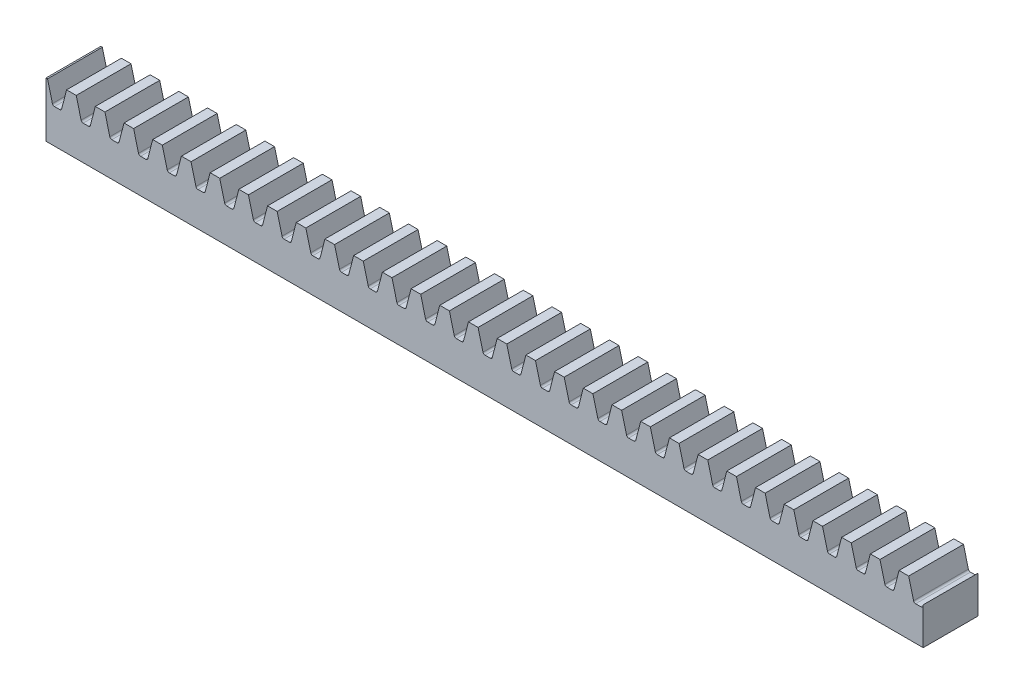
from build123d import *

# Parameters (mm, degrees)
SKETCH1_W           = 304.8
SKETCH1_H           = 6.35
BOSS_EXTRUDE1_DEPTH = 3.175
CUT_EXTRUDE1_DEPTH  = 6.35
FILLET3_R           = 0.244816447
LPATTERN4_START     = -3.175
LPATTERN4_DEPTH     = 6.35
SKETCH3_W           = 203.2
SKETCH3_H           = 22.446230099
CUT_EXTRUDE2_DEPTH  = 153.565274965


with BuildPart() as part:
    # Sketch1 → Boss-Extrude1 (new, symmetric)
    with BuildSketch(Plane.XY):
        Rectangle(SKETCH1_W, SKETCH1_H)
    extrude(amount=BOSS_EXTRUDE1_DEPTH, both=True)

    # Sketch2 → Cut-Extrude1 (cut)
    with BuildSketch(Plane.XY.offset(3.175)):
        Polygon((-151.84248861, 3.175), (-151.227202895, 0.795866667), (-150.247937105, 0.795866667), (-149.63265139, 3.175), align=None)
    extrude(amount=-CUT_EXTRUDE1_DEPTH, mode=Mode.SUBTRACT)

    # Fillet3
    fillet3_edges = [part.edges().sort_by_distance(p)[0] for p in [
        (-150.247937105, 0.795866667, 0),
        (-151.227202895, 0.795866667, 0),
    ]]
    fillet(fillet3_edges, radius=FILLET3_R)

    # LPattern4: read off the stored shape, not the designer's step
    # LPattern4 outline → LPattern4 (cut)
    with BuildSketch(Plane.XY.offset(LPATTERN4_START)):
        with BuildLine():
            ThreePointArc((-147.949804214, 0.979385971), (-147.862666607, 0.847109302), (-147.712785748, 0.795866667))
            Line((-147.712785748, 0.795866667), (-147.112634252, 0.795866667))
            ThreePointArc((-147.112634252, 0.795866667), (-146.962753393, 0.847109302), (-146.875615786, 0.979385971))
            Line((-146.875615786, 0.979385971), (-146.30779139, 3.175))
            Line((-146.30779139, 3.175), (-148.51762861, 3.175))
            Line((-148.51762861, 3.175), (-147.949804214, 0.979385971))
        make_face()
        with BuildLine():
            Line((152.4, 3.175), (150.71977139, 3.175))
            Line((150.71977139, 3.175), (151.287595786, 0.979385971))
            ThreePointArc((151.287595786, 0.979385971), (151.374733393, 0.847109302), (151.524614252, 0.795866667))
            Line((151.524614252, 0.795866667), (152.124765748, 0.795866667))
            ThreePointArc((152.124765748, 0.795866667), (152.274646607, 0.847109302), (152.361784214, 0.979385971))
            Line((152.361784214, 0.979385971), (152.4, 1.127155452))
            Line((152.4, 1.127155452), (152.4, 3.175))
        make_face()
        with BuildLine():
            Line((149.60474861, 3.175), (147.39491139, 3.175))
            Line((147.39491139, 3.175), (147.962735786, 0.979385971))
            ThreePointArc((147.962735786, 0.979385971), (148.049873393, 0.847109302), (148.199754252, 0.795866667))
            Line((148.199754252, 0.795866667), (148.799905748, 0.795866667))
            ThreePointArc((148.799905748, 0.795866667), (148.949786607, 0.847109302), (149.036924214, 0.979385971))
            Line((149.036924214, 0.979385971), (149.60474861, 3.175))
        make_face()
        with BuildLine():
            Line((146.27988861, 3.175), (144.07005139, 3.175))
            Line((144.07005139, 3.175), (144.637875786, 0.979385971))
            ThreePointArc((144.637875786, 0.979385971), (144.725013393, 0.847109302), (144.874894252, 0.795866667))
            Line((144.874894252, 0.795866667), (145.475045748, 0.795866667))
            ThreePointArc((145.475045748, 0.795866667), (145.624926607, 0.847109302), (145.712064214, 0.979385971))
            Line((145.712064214, 0.979385971), (146.27988861, 3.175))
        make_face()
        with BuildLine():
            Line((142.95502861, 3.175), (140.74519139, 3.175))
            Line((140.74519139, 3.175), (141.313015786, 0.979385971))
            ThreePointArc((141.313015786, 0.979385971), (141.400153393, 0.847109302), (141.550034252, 0.795866667))
            Line((141.550034252, 0.795866667), (142.150185748, 0.795866667))
            ThreePointArc((142.150185748, 0.795866667), (142.300066607, 0.847109302), (142.387204214, 0.979385971))
            Line((142.387204214, 0.979385971), (142.95502861, 3.175))
        make_face()
        with BuildLine():
            Line((139.63016861, 3.175), (137.42033139, 3.175))
            Line((137.42033139, 3.175), (137.988155786, 0.979385971))
            ThreePointArc((137.988155786, 0.979385971), (138.075293393, 0.847109302), (138.225174252, 0.795866667))
            Line((138.225174252, 0.795866667), (138.825325748, 0.795866667))
            ThreePointArc((138.825325748, 0.795866667), (138.975206607, 0.847109302), (139.062344214, 0.979385971))
            Line((139.062344214, 0.979385971), (139.63016861, 3.175))
        make_face()
        with BuildLine():
            Line((136.30530861, 3.175), (134.09547139, 3.175))
            Line((134.09547139, 3.175), (134.663295786, 0.979385971))
            ThreePointArc((134.663295786, 0.979385971), (134.750433393, 0.847109302), (134.900314252, 0.795866667))
            Line((134.900314252, 0.795866667), (135.500465748, 0.795866667))
            ThreePointArc((135.500465748, 0.795866667), (135.650346607, 0.847109302), (135.737484214, 0.979385971))
            Line((135.737484214, 0.979385971), (136.30530861, 3.175))
        make_face()
        with BuildLine():
            Line((132.98044861, 3.175), (130.77061139, 3.175))
            Line((130.77061139, 3.175), (131.338435786, 0.979385971))
            ThreePointArc((131.338435786, 0.979385971), (131.425573393, 0.847109302), (131.575454252, 0.795866667))
            Line((131.575454252, 0.795866667), (132.175605748, 0.795866667))
            ThreePointArc((132.175605748, 0.795866667), (132.325486607, 0.847109302), (132.412624214, 0.979385971))
            Line((132.412624214, 0.979385971), (132.98044861, 3.175))
        make_face()
        with BuildLine():
            Line((129.65558861, 3.175), (127.44575139, 3.175))
            Line((127.44575139, 3.175), (128.013575786, 0.979385971))
            ThreePointArc((128.013575786, 0.979385971), (128.100713393, 0.847109302), (128.250594252, 0.795866667))
            Line((128.250594252, 0.795866667), (128.850745748, 0.795866667))
            ThreePointArc((128.850745748, 0.795866667), (129.000626607, 0.847109302), (129.087764214, 0.979385971))
            Line((129.087764214, 0.979385971), (129.65558861, 3.175))
        make_face()
        with BuildLine():
            Line((126.33072861, 3.175), (124.12089139, 3.175))
            Line((124.12089139, 3.175), (124.688715786, 0.979385971))
            ThreePointArc((124.688715786, 0.979385971), (124.775853393, 0.847109302), (124.925734252, 0.795866667))
            Line((124.925734252, 0.795866667), (125.525885748, 0.795866667))
            ThreePointArc((125.525885748, 0.795866667), (125.675766607, 0.847109302), (125.762904214, 0.979385971))
            Line((125.762904214, 0.979385971), (126.33072861, 3.175))
        make_face()
        with BuildLine():
            Line((123.00586861, 3.175), (120.79603139, 3.175))
            Line((120.79603139, 3.175), (121.363855786, 0.979385971))
            ThreePointArc((121.363855786, 0.979385971), (121.450993393, 0.847109302), (121.600874252, 0.795866667))
            Line((121.600874252, 0.795866667), (122.201025748, 0.795866667))
            ThreePointArc((122.201025748, 0.795866667), (122.350906607, 0.847109302), (122.438044214, 0.979385971))
            Line((122.438044214, 0.979385971), (123.00586861, 3.175))
        make_face()
        with BuildLine():
            Line((119.68100861, 3.175), (117.47117139, 3.175))
            Line((117.47117139, 3.175), (118.038995786, 0.979385971))
            ThreePointArc((118.038995786, 0.979385971), (118.126133393, 0.847109302), (118.276014252, 0.795866667))
            Line((118.276014252, 0.795866667), (118.876165748, 0.795866667))
            ThreePointArc((118.876165748, 0.795866667), (119.026046607, 0.847109302), (119.113184214, 0.979385971))
            Line((119.113184214, 0.979385971), (119.68100861, 3.175))
        make_face()
        with BuildLine():
            Line((116.35614861, 3.175), (114.14631139, 3.175))
            Line((114.14631139, 3.175), (114.714135786, 0.979385971))
            ThreePointArc((114.714135786, 0.979385971), (114.801273393, 0.847109302), (114.951154252, 0.795866667))
            Line((114.951154252, 0.795866667), (115.551305748, 0.795866667))
            ThreePointArc((115.551305748, 0.795866667), (115.701186607, 0.847109302), (115.788324214, 0.979385971))
            Line((115.788324214, 0.979385971), (116.35614861, 3.175))
        make_face()
        with BuildLine():
            Line((113.03128861, 3.175), (110.82145139, 3.175))
            Line((110.82145139, 3.175), (111.389275786, 0.979385971))
            ThreePointArc((111.389275786, 0.979385971), (111.476413393, 0.847109302), (111.626294252, 0.795866667))
            Line((111.626294252, 0.795866667), (112.226445748, 0.795866667))
            ThreePointArc((112.226445748, 0.795866667), (112.376326607, 0.847109302), (112.463464214, 0.979385971))
            Line((112.463464214, 0.979385971), (113.03128861, 3.175))
        make_face()
        with BuildLine():
            Line((109.70642861, 3.175), (107.49659139, 3.175))
            Line((107.49659139, 3.175), (108.064415786, 0.979385971))
            ThreePointArc((108.064415786, 0.979385971), (108.151553393, 0.847109302), (108.301434252, 0.795866667))
            Line((108.301434252, 0.795866667), (108.901585748, 0.795866667))
            ThreePointArc((108.901585748, 0.795866667), (109.051466607, 0.847109302), (109.138604214, 0.979385971))
            Line((109.138604214, 0.979385971), (109.70642861, 3.175))
        make_face()
        with BuildLine():
            Line((106.38156861, 3.175), (104.17173139, 3.175))
            Line((104.17173139, 3.175), (104.739555786, 0.979385971))
            ThreePointArc((104.739555786, 0.979385971), (104.826693393, 0.847109302), (104.976574252, 0.795866667))
            Line((104.976574252, 0.795866667), (105.576725748, 0.795866667))
            ThreePointArc((105.576725748, 0.795866667), (105.726606607, 0.847109302), (105.813744214, 0.979385971))
            Line((105.813744214, 0.979385971), (106.38156861, 3.175))
        make_face()
        with BuildLine():
            Line((103.05670861, 3.175), (100.84687139, 3.175))
            Line((100.84687139, 3.175), (101.414695786, 0.979385971))
            ThreePointArc((101.414695786, 0.979385971), (101.501833393, 0.847109302), (101.651714252, 0.795866667))
            Line((101.651714252, 0.795866667), (102.251865748, 0.795866667))
            ThreePointArc((102.251865748, 0.795866667), (102.401746607, 0.847109302), (102.488884214, 0.979385971))
            Line((102.488884214, 0.979385971), (103.05670861, 3.175))
        make_face()
        with BuildLine():
            Line((99.73184861, 3.175), (97.52201139, 3.175))
            Line((97.52201139, 3.175), (98.089835786, 0.979385971))
            ThreePointArc((98.089835786, 0.979385971), (98.176973393, 0.847109302), (98.326854252, 0.795866667))
            Line((98.326854252, 0.795866667), (98.927005748, 0.795866667))
            ThreePointArc((98.927005748, 0.795866667), (99.076886607, 0.847109302), (99.164024214, 0.979385971))
            Line((99.164024214, 0.979385971), (99.73184861, 3.175))
        make_face()
        with BuildLine():
            Line((96.40698861, 3.175), (94.19715139, 3.175))
            Line((94.19715139, 3.175), (94.764975786, 0.979385971))
            ThreePointArc((94.764975786, 0.979385971), (94.852113393, 0.847109302), (95.001994252, 0.795866667))
            Line((95.001994252, 0.795866667), (95.602145748, 0.795866667))
            ThreePointArc((95.602145748, 0.795866667), (95.752026607, 0.847109302), (95.839164214, 0.979385971))
            Line((95.839164214, 0.979385971), (96.40698861, 3.175))
        make_face()
        with BuildLine():
            Line((93.08212861, 3.175), (90.87229139, 3.175))
            Line((90.87229139, 3.175), (91.440115786, 0.979385971))
            ThreePointArc((91.440115786, 0.979385971), (91.527253393, 0.847109302), (91.677134252, 0.795866667))
            Line((91.677134252, 0.795866667), (92.277285748, 0.795866667))
            ThreePointArc((92.277285748, 0.795866667), (92.427166607, 0.847109302), (92.514304214, 0.979385971))
            Line((92.514304214, 0.979385971), (93.08212861, 3.175))
        make_face()
        with BuildLine():
            Line((89.75726861, 3.175), (87.54743139, 3.175))
            Line((87.54743139, 3.175), (88.115255786, 0.979385971))
            ThreePointArc((88.115255786, 0.979385971), (88.202393393, 0.847109302), (88.352274252, 0.795866667))
            Line((88.352274252, 0.795866667), (88.952425748, 0.795866667))
            ThreePointArc((88.952425748, 0.795866667), (89.102306607, 0.847109302), (89.189444214, 0.979385971))
            Line((89.189444214, 0.979385971), (89.75726861, 3.175))
        make_face()
        with BuildLine():
            Line((86.43240861, 3.175), (84.22257139, 3.175))
            Line((84.22257139, 3.175), (84.790395786, 0.979385971))
            ThreePointArc((84.790395786, 0.979385971), (84.877533393, 0.847109302), (85.027414252, 0.795866667))
            Line((85.027414252, 0.795866667), (85.627565748, 0.795866667))
            ThreePointArc((85.627565748, 0.795866667), (85.777446607, 0.847109302), (85.864584214, 0.979385971))
            Line((85.864584214, 0.979385971), (86.43240861, 3.175))
        make_face()
        with BuildLine():
            Line((83.10754861, 3.175), (80.89771139, 3.175))
            Line((80.89771139, 3.175), (81.465535786, 0.979385971))
            ThreePointArc((81.465535786, 0.979385971), (81.552673393, 0.847109302), (81.702554252, 0.795866667))
            Line((81.702554252, 0.795866667), (82.302705748, 0.795866667))
            ThreePointArc((82.302705748, 0.795866667), (82.452586607, 0.847109302), (82.539724214, 0.979385971))
            Line((82.539724214, 0.979385971), (83.10754861, 3.175))
        make_face()
        with BuildLine():
            Line((79.78268861, 3.175), (77.57285139, 3.175))
            Line((77.57285139, 3.175), (78.140675786, 0.979385971))
            ThreePointArc((78.140675786, 0.979385971), (78.227813393, 0.847109302), (78.377694252, 0.795866667))
            Line((78.377694252, 0.795866667), (78.977845748, 0.795866667))
            ThreePointArc((78.977845748, 0.795866667), (79.127726607, 0.847109302), (79.214864214, 0.979385971))
            Line((79.214864214, 0.979385971), (79.78268861, 3.175))
        make_face()
        with BuildLine():
            Line((76.45782861, 3.175), (74.24799139, 3.175))
            Line((74.24799139, 3.175), (74.815815786, 0.979385971))
            ThreePointArc((74.815815786, 0.979385971), (74.902953393, 0.847109302), (75.052834252, 0.795866667))
            Line((75.052834252, 0.795866667), (75.652985748, 0.795866667))
            ThreePointArc((75.652985748, 0.795866667), (75.802866607, 0.847109302), (75.890004214, 0.979385971))
            Line((75.890004214, 0.979385971), (76.45782861, 3.175))
        make_face()
        with BuildLine():
            Line((73.13296861, 3.175), (70.92313139, 3.175))
            Line((70.92313139, 3.175), (71.490955786, 0.979385971))
            ThreePointArc((71.490955786, 0.979385971), (71.578093393, 0.847109302), (71.727974252, 0.795866667))
            Line((71.727974252, 0.795866667), (72.328125748, 0.795866667))
            ThreePointArc((72.328125748, 0.795866667), (72.478006607, 0.847109302), (72.565144214, 0.979385971))
            Line((72.565144214, 0.979385971), (73.13296861, 3.175))
        make_face()
        with BuildLine():
            Line((69.80810861, 3.175), (67.59827139, 3.175))
            Line((67.59827139, 3.175), (68.166095786, 0.979385971))
            ThreePointArc((68.166095786, 0.979385971), (68.253233393, 0.847109302), (68.403114252, 0.795866667))
            Line((68.403114252, 0.795866667), (69.003265748, 0.795866667))
            ThreePointArc((69.003265748, 0.795866667), (69.153146607, 0.847109302), (69.240284214, 0.979385971))
            Line((69.240284214, 0.979385971), (69.80810861, 3.175))
        make_face()
        with BuildLine():
            Line((66.48324861, 3.175), (64.27341139, 3.175))
            Line((64.27341139, 3.175), (64.841235786, 0.979385971))
            ThreePointArc((64.841235786, 0.979385971), (64.928373393, 0.847109302), (65.078254252, 0.795866667))
            Line((65.078254252, 0.795866667), (65.678405748, 0.795866667))
            ThreePointArc((65.678405748, 0.795866667), (65.828286607, 0.847109302), (65.915424214, 0.979385971))
            Line((65.915424214, 0.979385971), (66.48324861, 3.175))
        make_face()
        with BuildLine():
            Line((63.15838861, 3.175), (60.94855139, 3.175))
            Line((60.94855139, 3.175), (61.516375786, 0.979385971))
            ThreePointArc((61.516375786, 0.979385971), (61.603513393, 0.847109302), (61.753394252, 0.795866667))
            Line((61.753394252, 0.795866667), (62.353545748, 0.795866667))
            ThreePointArc((62.353545748, 0.795866667), (62.503426607, 0.847109302), (62.590564214, 0.979385971))
            Line((62.590564214, 0.979385971), (63.15838861, 3.175))
        make_face()
        with BuildLine():
            Line((59.83352861, 3.175), (57.62369139, 3.175))
            Line((57.62369139, 3.175), (58.191515786, 0.979385971))
            ThreePointArc((58.191515786, 0.979385971), (58.278653393, 0.847109302), (58.428534252, 0.795866667))
            Line((58.428534252, 0.795866667), (59.028685748, 0.795866667))
            ThreePointArc((59.028685748, 0.795866667), (59.178566607, 0.847109302), (59.265704214, 0.979385971))
            Line((59.265704214, 0.979385971), (59.83352861, 3.175))
        make_face()
        with BuildLine():
            Line((56.50866861, 3.175), (54.29883139, 3.175))
            Line((54.29883139, 3.175), (54.866655786, 0.979385971))
            ThreePointArc((54.866655786, 0.979385971), (54.953793393, 0.847109302), (55.103674252, 0.795866667))
            Line((55.103674252, 0.795866667), (55.703825748, 0.795866667))
            ThreePointArc((55.703825748, 0.795866667), (55.853706607, 0.847109302), (55.940844214, 0.979385971))
            Line((55.940844214, 0.979385971), (56.50866861, 3.175))
        make_face()
        with BuildLine():
            Line((53.18380861, 3.175), (50.97397139, 3.175))
            Line((50.97397139, 3.175), (51.541795786, 0.979385971))
            ThreePointArc((51.541795786, 0.979385971), (51.628933393, 0.847109302), (51.778814252, 0.795866667))
            Line((51.778814252, 0.795866667), (52.378965748, 0.795866667))
            ThreePointArc((52.378965748, 0.795866667), (52.528846607, 0.847109302), (52.615984214, 0.979385971))
            Line((52.615984214, 0.979385971), (53.18380861, 3.175))
        make_face()
        with BuildLine():
            Line((49.85894861, 3.175), (47.64911139, 3.175))
            Line((47.64911139, 3.175), (48.216935786, 0.979385971))
            ThreePointArc((48.216935786, 0.979385971), (48.304073393, 0.847109302), (48.453954252, 0.795866667))
            Line((48.453954252, 0.795866667), (49.054105748, 0.795866667))
            ThreePointArc((49.054105748, 0.795866667), (49.203986607, 0.847109302), (49.291124214, 0.979385971))
            Line((49.291124214, 0.979385971), (49.85894861, 3.175))
        make_face()
        with BuildLine():
            Line((46.53408861, 3.175), (44.32425139, 3.175))
            Line((44.32425139, 3.175), (44.892075786, 0.979385971))
            ThreePointArc((44.892075786, 0.979385971), (44.979213393, 0.847109302), (45.129094252, 0.795866667))
            Line((45.129094252, 0.795866667), (45.729245748, 0.795866667))
            ThreePointArc((45.729245748, 0.795866667), (45.879126607, 0.847109302), (45.966264214, 0.979385971))
            Line((45.966264214, 0.979385971), (46.53408861, 3.175))
        make_face()
        with BuildLine():
            Line((43.20922861, 3.175), (40.99939139, 3.175))
            Line((40.99939139, 3.175), (41.567215786, 0.979385971))
            ThreePointArc((41.567215786, 0.979385971), (41.654353393, 0.847109302), (41.804234252, 0.795866667))
            Line((41.804234252, 0.795866667), (42.404385748, 0.795866667))
            ThreePointArc((42.404385748, 0.795866667), (42.554266607, 0.847109302), (42.641404214, 0.979385971))
            Line((42.641404214, 0.979385971), (43.20922861, 3.175))
        make_face()
        with BuildLine():
            Line((39.88436861, 3.175), (37.67453139, 3.175))
            Line((37.67453139, 3.175), (38.242355786, 0.979385971))
            ThreePointArc((38.242355786, 0.979385971), (38.329493393, 0.847109302), (38.479374252, 0.795866667))
            Line((38.479374252, 0.795866667), (39.079525748, 0.795866667))
            ThreePointArc((39.079525748, 0.795866667), (39.229406607, 0.847109302), (39.316544214, 0.979385971))
            Line((39.316544214, 0.979385971), (39.88436861, 3.175))
        make_face()
        with BuildLine():
            Line((36.55950861, 3.175), (34.34967139, 3.175))
            Line((34.34967139, 3.175), (34.917495786, 0.979385971))
            ThreePointArc((34.917495786, 0.979385971), (35.004633393, 0.847109302), (35.154514252, 0.795866667))
            Line((35.154514252, 0.795866667), (35.754665748, 0.795866667))
            ThreePointArc((35.754665748, 0.795866667), (35.904546607, 0.847109302), (35.991684214, 0.979385971))
            Line((35.991684214, 0.979385971), (36.55950861, 3.175))
        make_face()
        with BuildLine():
            Line((33.23464861, 3.175), (31.02481139, 3.175))
            Line((31.02481139, 3.175), (31.592635786, 0.979385971))
            ThreePointArc((31.592635786, 0.979385971), (31.679773393, 0.847109302), (31.829654252, 0.795866667))
            Line((31.829654252, 0.795866667), (32.429805748, 0.795866667))
            ThreePointArc((32.429805748, 0.795866667), (32.579686607, 0.847109302), (32.666824214, 0.979385971))
            Line((32.666824214, 0.979385971), (33.23464861, 3.175))
        make_face()
        with BuildLine():
            Line((29.90978861, 3.175), (27.69995139, 3.175))
            Line((27.69995139, 3.175), (28.267775786, 0.979385971))
            ThreePointArc((28.267775786, 0.979385971), (28.354913393, 0.847109302), (28.504794252, 0.795866667))
            Line((28.504794252, 0.795866667), (29.104945748, 0.795866667))
            ThreePointArc((29.104945748, 0.795866667), (29.254826607, 0.847109302), (29.341964214, 0.979385971))
            Line((29.341964214, 0.979385971), (29.90978861, 3.175))
        make_face()
        with BuildLine():
            Line((26.58492861, 3.175), (24.37509139, 3.175))
            Line((24.37509139, 3.175), (24.942915786, 0.979385971))
            ThreePointArc((24.942915786, 0.979385971), (25.030053393, 0.847109302), (25.179934252, 0.795866667))
            Line((25.179934252, 0.795866667), (25.780085748, 0.795866667))
            ThreePointArc((25.780085748, 0.795866667), (25.929966607, 0.847109302), (26.017104214, 0.979385971))
            Line((26.017104214, 0.979385971), (26.58492861, 3.175))
        make_face()
        with BuildLine():
            Line((23.26006861, 3.175), (21.05023139, 3.175))
            Line((21.05023139, 3.175), (21.618055786, 0.979385971))
            ThreePointArc((21.618055786, 0.979385971), (21.705193393, 0.847109302), (21.855074252, 0.795866667))
            Line((21.855074252, 0.795866667), (22.455225748, 0.795866667))
            ThreePointArc((22.455225748, 0.795866667), (22.605106607, 0.847109302), (22.692244214, 0.979385971))
            Line((22.692244214, 0.979385971), (23.26006861, 3.175))
        make_face()
        with BuildLine():
            Line((19.93520861, 3.175), (17.72537139, 3.175))
            Line((17.72537139, 3.175), (18.293195786, 0.979385971))
            ThreePointArc((18.293195786, 0.979385971), (18.380333393, 0.847109302), (18.530214252, 0.795866667))
            Line((18.530214252, 0.795866667), (19.130365748, 0.795866667))
            ThreePointArc((19.130365748, 0.795866667), (19.280246607, 0.847109302), (19.367384214, 0.979385971))
            Line((19.367384214, 0.979385971), (19.93520861, 3.175))
        make_face()
        with BuildLine():
            Line((16.61034861, 3.175), (14.40051139, 3.175))
            Line((14.40051139, 3.175), (14.968335786, 0.979385971))
            ThreePointArc((14.968335786, 0.979385971), (15.055473393, 0.847109302), (15.205354252, 0.795866667))
            Line((15.205354252, 0.795866667), (15.805505748, 0.795866667))
            ThreePointArc((15.805505748, 0.795866667), (15.955386607, 0.847109302), (16.042524214, 0.979385971))
            Line((16.042524214, 0.979385971), (16.61034861, 3.175))
        make_face()
        with BuildLine():
            Line((13.28548861, 3.175), (11.07565139, 3.175))
            Line((11.07565139, 3.175), (11.643475786, 0.979385971))
            ThreePointArc((11.643475786, 0.979385971), (11.730613393, 0.847109302), (11.880494252, 0.795866667))
            Line((11.880494252, 0.795866667), (12.480645748, 0.795866667))
            ThreePointArc((12.480645748, 0.795866667), (12.630526607, 0.847109302), (12.717664214, 0.979385971))
            Line((12.717664214, 0.979385971), (13.28548861, 3.175))
        make_face()
        with BuildLine():
            Line((9.96062861, 3.175), (7.75079139, 3.175))
            Line((7.75079139, 3.175), (8.318615786, 0.979385971))
            ThreePointArc((8.318615786, 0.979385971), (8.405753393, 0.847109302), (8.555634252, 0.795866667))
            Line((8.555634252, 0.795866667), (9.155785748, 0.795866667))
            ThreePointArc((9.155785748, 0.795866667), (9.305666607, 0.847109302), (9.392804214, 0.979385971))
            Line((9.392804214, 0.979385971), (9.96062861, 3.175))
        make_face()
        with BuildLine():
            Line((6.63576861, 3.175), (4.42593139, 3.175))
            Line((4.42593139, 3.175), (4.993755786, 0.979385971))
            ThreePointArc((4.993755786, 0.979385971), (5.080893393, 0.847109302), (5.230774252, 0.795866667))
            Line((5.230774252, 0.795866667), (5.830925748, 0.795866667))
            ThreePointArc((5.830925748, 0.795866667), (5.980806607, 0.847109302), (6.067944214, 0.979385971))
            Line((6.067944214, 0.979385971), (6.63576861, 3.175))
        make_face()
        with BuildLine():
            Line((3.31090861, 3.175), (1.10107139, 3.175))
            Line((1.10107139, 3.175), (1.668895786, 0.979385971))
            ThreePointArc((1.668895786, 0.979385971), (1.756033393, 0.847109302), (1.905914252, 0.795866667))
            Line((1.905914252, 0.795866667), (2.506065748, 0.795866667))
            ThreePointArc((2.506065748, 0.795866667), (2.655946607, 0.847109302), (2.743084214, 0.979385971))
            Line((2.743084214, 0.979385971), (3.31090861, 3.175))
        make_face()
        with BuildLine():
            Line((-0.01395139, 3.175), (-2.22378861, 3.175))
            Line((-2.22378861, 3.175), (-1.655964214, 0.979385971))
            ThreePointArc((-1.655964214, 0.979385971), (-1.568826607, 0.847109302), (-1.418945748, 0.795866667))
            Line((-1.418945748, 0.795866667), (-0.818794252, 0.795866667))
            ThreePointArc((-0.818794252, 0.795866667), (-0.668913393, 0.847109302), (-0.581775786, 0.979385971))
            Line((-0.581775786, 0.979385971), (-0.01395139, 3.175))
        make_face()
        with BuildLine():
            Line((-3.33881139, 3.175), (-5.54864861, 3.175))
            Line((-5.54864861, 3.175), (-4.980824214, 0.979385971))
            ThreePointArc((-4.980824214, 0.979385971), (-4.893686607, 0.847109302), (-4.743805748, 0.795866667))
            Line((-4.743805748, 0.795866667), (-4.143654252, 0.795866667))
            ThreePointArc((-4.143654252, 0.795866667), (-3.993773393, 0.847109302), (-3.906635786, 0.979385971))
            Line((-3.906635786, 0.979385971), (-3.33881139, 3.175))
        make_face()
        with BuildLine():
            Line((-6.66367139, 3.175), (-8.87350861, 3.175))
            Line((-8.87350861, 3.175), (-8.305684214, 0.979385971))
            ThreePointArc((-8.305684214, 0.979385971), (-8.218546607, 0.847109302), (-8.068665748, 0.795866667))
            Line((-8.068665748, 0.795866667), (-7.468514252, 0.795866667))
            ThreePointArc((-7.468514252, 0.795866667), (-7.318633393, 0.847109302), (-7.231495786, 0.979385971))
            Line((-7.231495786, 0.979385971), (-6.66367139, 3.175))
        make_face()
        with BuildLine():
            Line((-9.98853139, 3.175), (-12.19836861, 3.175))
            Line((-12.19836861, 3.175), (-11.630544214, 0.979385971))
            ThreePointArc((-11.630544214, 0.979385971), (-11.543406607, 0.847109302), (-11.393525748, 0.795866667))
            Line((-11.393525748, 0.795866667), (-10.793374252, 0.795866667))
            ThreePointArc((-10.793374252, 0.795866667), (-10.643493393, 0.847109302), (-10.556355786, 0.979385971))
            Line((-10.556355786, 0.979385971), (-9.98853139, 3.175))
        make_face()
        with BuildLine():
            Line((-13.31339139, 3.175), (-15.52322861, 3.175))
            Line((-15.52322861, 3.175), (-14.955404214, 0.979385971))
            ThreePointArc((-14.955404214, 0.979385971), (-14.868266607, 0.847109302), (-14.718385748, 0.795866667))
            Line((-14.718385748, 0.795866667), (-14.118234252, 0.795866667))
            ThreePointArc((-14.118234252, 0.795866667), (-13.968353393, 0.847109302), (-13.881215786, 0.979385971))
            Line((-13.881215786, 0.979385971), (-13.31339139, 3.175))
        make_face()
        with BuildLine():
            Line((-16.63825139, 3.175), (-18.84808861, 3.175))
            Line((-18.84808861, 3.175), (-18.280264214, 0.979385971))
            ThreePointArc((-18.280264214, 0.979385971), (-18.193126607, 0.847109302), (-18.043245748, 0.795866667))
            Line((-18.043245748, 0.795866667), (-17.443094252, 0.795866667))
            ThreePointArc((-17.443094252, 0.795866667), (-17.293213393, 0.847109302), (-17.206075786, 0.979385971))
            Line((-17.206075786, 0.979385971), (-16.63825139, 3.175))
        make_face()
        with BuildLine():
            Line((-19.96311139, 3.175), (-22.17294861, 3.175))
            Line((-22.17294861, 3.175), (-21.605124214, 0.979385971))
            ThreePointArc((-21.605124214, 0.979385971), (-21.517986607, 0.847109302), (-21.368105748, 0.795866667))
            Line((-21.368105748, 0.795866667), (-20.767954252, 0.795866667))
            ThreePointArc((-20.767954252, 0.795866667), (-20.618073393, 0.847109302), (-20.530935786, 0.979385971))
            Line((-20.530935786, 0.979385971), (-19.96311139, 3.175))
        make_face()
        with BuildLine():
            Line((-23.28797139, 3.175), (-25.49780861, 3.175))
            Line((-25.49780861, 3.175), (-24.929984214, 0.979385971))
            ThreePointArc((-24.929984214, 0.979385971), (-24.842846607, 0.847109302), (-24.692965748, 0.795866667))
            Line((-24.692965748, 0.795866667), (-24.092814252, 0.795866667))
            ThreePointArc((-24.092814252, 0.795866667), (-23.942933393, 0.847109302), (-23.855795786, 0.979385971))
            Line((-23.855795786, 0.979385971), (-23.28797139, 3.175))
        make_face()
        with BuildLine():
            Line((-26.61283139, 3.175), (-28.82266861, 3.175))
            Line((-28.82266861, 3.175), (-28.254844214, 0.979385971))
            ThreePointArc((-28.254844214, 0.979385971), (-28.167706607, 0.847109302), (-28.017825748, 0.795866667))
            Line((-28.017825748, 0.795866667), (-27.417674252, 0.795866667))
            ThreePointArc((-27.417674252, 0.795866667), (-27.267793393, 0.847109302), (-27.180655786, 0.979385971))
            Line((-27.180655786, 0.979385971), (-26.61283139, 3.175))
        make_face()
        with BuildLine():
            Line((-29.93769139, 3.175), (-32.14752861, 3.175))
            Line((-32.14752861, 3.175), (-31.579704214, 0.979385971))
            ThreePointArc((-31.579704214, 0.979385971), (-31.492566607, 0.847109302), (-31.342685748, 0.795866667))
            Line((-31.342685748, 0.795866667), (-30.742534252, 0.795866667))
            ThreePointArc((-30.742534252, 0.795866667), (-30.592653393, 0.847109302), (-30.505515786, 0.979385971))
            Line((-30.505515786, 0.979385971), (-29.93769139, 3.175))
        make_face()
        with BuildLine():
            Line((-33.26255139, 3.175), (-35.47238861, 3.175))
            Line((-35.47238861, 3.175), (-34.904564214, 0.979385971))
            ThreePointArc((-34.904564214, 0.979385971), (-34.817426607, 0.847109302), (-34.667545748, 0.795866667))
            Line((-34.667545748, 0.795866667), (-34.067394252, 0.795866667))
            ThreePointArc((-34.067394252, 0.795866667), (-33.917513393, 0.847109302), (-33.830375786, 0.979385971))
            Line((-33.830375786, 0.979385971), (-33.26255139, 3.175))
        make_face()
        with BuildLine():
            Line((-36.58741139, 3.175), (-38.79724861, 3.175))
            Line((-38.79724861, 3.175), (-38.229424214, 0.979385971))
            ThreePointArc((-38.229424214, 0.979385971), (-38.142286607, 0.847109302), (-37.992405748, 0.795866667))
            Line((-37.992405748, 0.795866667), (-37.392254252, 0.795866667))
            ThreePointArc((-37.392254252, 0.795866667), (-37.242373393, 0.847109302), (-37.155235786, 0.979385971))
            Line((-37.155235786, 0.979385971), (-36.58741139, 3.175))
        make_face()
        with BuildLine():
            Line((-39.91227139, 3.175), (-42.12210861, 3.175))
            Line((-42.12210861, 3.175), (-41.554284214, 0.979385971))
            ThreePointArc((-41.554284214, 0.979385971), (-41.467146607, 0.847109302), (-41.317265748, 0.795866667))
            Line((-41.317265748, 0.795866667), (-40.717114252, 0.795866667))
            ThreePointArc((-40.717114252, 0.795866667), (-40.567233393, 0.847109302), (-40.480095786, 0.979385971))
            Line((-40.480095786, 0.979385971), (-39.91227139, 3.175))
        make_face()
        with BuildLine():
            Line((-43.23713139, 3.175), (-45.44696861, 3.175))
            Line((-45.44696861, 3.175), (-44.879144214, 0.979385971))
            ThreePointArc((-44.879144214, 0.979385971), (-44.792006607, 0.847109302), (-44.642125748, 0.795866667))
            Line((-44.642125748, 0.795866667), (-44.041974252, 0.795866667))
            ThreePointArc((-44.041974252, 0.795866667), (-43.892093393, 0.847109302), (-43.804955786, 0.979385971))
            Line((-43.804955786, 0.979385971), (-43.23713139, 3.175))
        make_face()
        with BuildLine():
            Line((-46.56199139, 3.175), (-48.77182861, 3.175))
            Line((-48.77182861, 3.175), (-48.204004214, 0.979385971))
            ThreePointArc((-48.204004214, 0.979385971), (-48.116866607, 0.847109302), (-47.966985748, 0.795866667))
            Line((-47.966985748, 0.795866667), (-47.366834252, 0.795866667))
            ThreePointArc((-47.366834252, 0.795866667), (-47.216953393, 0.847109302), (-47.129815786, 0.979385971))
            Line((-47.129815786, 0.979385971), (-46.56199139, 3.175))
        make_face()
        with BuildLine():
            Line((-49.88685139, 3.175), (-52.09668861, 3.175))
            Line((-52.09668861, 3.175), (-51.528864214, 0.979385971))
            ThreePointArc((-51.528864214, 0.979385971), (-51.441726607, 0.847109302), (-51.291845748, 0.795866667))
            Line((-51.291845748, 0.795866667), (-50.691694252, 0.795866667))
            ThreePointArc((-50.691694252, 0.795866667), (-50.541813393, 0.847109302), (-50.454675786, 0.979385971))
            Line((-50.454675786, 0.979385971), (-49.88685139, 3.175))
        make_face()
        with BuildLine():
            Line((-53.21171139, 3.175), (-55.42154861, 3.175))
            Line((-55.42154861, 3.175), (-54.853724214, 0.979385971))
            ThreePointArc((-54.853724214, 0.979385971), (-54.766586607, 0.847109302), (-54.616705748, 0.795866667))
            Line((-54.616705748, 0.795866667), (-54.016554252, 0.795866667))
            ThreePointArc((-54.016554252, 0.795866667), (-53.866673393, 0.847109302), (-53.779535786, 0.979385971))
            Line((-53.779535786, 0.979385971), (-53.21171139, 3.175))
        make_face()
        with BuildLine():
            Line((-56.53657139, 3.175), (-58.74640861, 3.175))
            Line((-58.74640861, 3.175), (-58.178584214, 0.979385971))
            ThreePointArc((-58.178584214, 0.979385971), (-58.091446607, 0.847109302), (-57.941565748, 0.795866667))
            Line((-57.941565748, 0.795866667), (-57.341414252, 0.795866667))
            ThreePointArc((-57.341414252, 0.795866667), (-57.191533393, 0.847109302), (-57.104395786, 0.979385971))
            Line((-57.104395786, 0.979385971), (-56.53657139, 3.175))
        make_face()
        with BuildLine():
            Line((-59.86143139, 3.175), (-62.07126861, 3.175))
            Line((-62.07126861, 3.175), (-61.503444214, 0.979385971))
            ThreePointArc((-61.503444214, 0.979385971), (-61.416306607, 0.847109302), (-61.266425748, 0.795866667))
            Line((-61.266425748, 0.795866667), (-60.666274252, 0.795866667))
            ThreePointArc((-60.666274252, 0.795866667), (-60.516393393, 0.847109302), (-60.429255786, 0.979385971))
            Line((-60.429255786, 0.979385971), (-59.86143139, 3.175))
        make_face()
        with BuildLine():
            Line((-63.18629139, 3.175), (-65.39612861, 3.175))
            Line((-65.39612861, 3.175), (-64.828304214, 0.979385971))
            ThreePointArc((-64.828304214, 0.979385971), (-64.741166607, 0.847109302), (-64.591285748, 0.795866667))
            Line((-64.591285748, 0.795866667), (-63.991134252, 0.795866667))
            ThreePointArc((-63.991134252, 0.795866667), (-63.841253393, 0.847109302), (-63.754115786, 0.979385971))
            Line((-63.754115786, 0.979385971), (-63.18629139, 3.175))
        make_face()
        with BuildLine():
            Line((-66.51115139, 3.175), (-68.72098861, 3.175))
            Line((-68.72098861, 3.175), (-68.153164214, 0.979385971))
            ThreePointArc((-68.153164214, 0.979385971), (-68.066026607, 0.847109302), (-67.916145748, 0.795866667))
            Line((-67.916145748, 0.795866667), (-67.315994252, 0.795866667))
            ThreePointArc((-67.315994252, 0.795866667), (-67.166113393, 0.847109302), (-67.078975786, 0.979385971))
            Line((-67.078975786, 0.979385971), (-66.51115139, 3.175))
        make_face()
        with BuildLine():
            Line((-69.83601139, 3.175), (-72.04584861, 3.175))
            Line((-72.04584861, 3.175), (-71.478024214, 0.979385971))
            ThreePointArc((-71.478024214, 0.979385971), (-71.390886607, 0.847109302), (-71.241005748, 0.795866667))
            Line((-71.241005748, 0.795866667), (-70.640854252, 0.795866667))
            ThreePointArc((-70.640854252, 0.795866667), (-70.490973393, 0.847109302), (-70.403835786, 0.979385971))
            Line((-70.403835786, 0.979385971), (-69.83601139, 3.175))
        make_face()
        with BuildLine():
            Line((-73.16087139, 3.175), (-75.37070861, 3.175))
            Line((-75.37070861, 3.175), (-74.802884214, 0.979385971))
            ThreePointArc((-74.802884214, 0.979385971), (-74.715746607, 0.847109302), (-74.565865748, 0.795866667))
            Line((-74.565865748, 0.795866667), (-73.965714252, 0.795866667))
            ThreePointArc((-73.965714252, 0.795866667), (-73.815833393, 0.847109302), (-73.728695786, 0.979385971))
            Line((-73.728695786, 0.979385971), (-73.16087139, 3.175))
        make_face()
        with BuildLine():
            Line((-76.48573139, 3.175), (-78.69556861, 3.175))
            Line((-78.69556861, 3.175), (-78.127744214, 0.979385971))
            ThreePointArc((-78.127744214, 0.979385971), (-78.040606607, 0.847109302), (-77.890725748, 0.795866667))
            Line((-77.890725748, 0.795866667), (-77.290574252, 0.795866667))
            ThreePointArc((-77.290574252, 0.795866667), (-77.140693393, 0.847109302), (-77.053555786, 0.979385971))
            Line((-77.053555786, 0.979385971), (-76.48573139, 3.175))
        make_face()
        with BuildLine():
            Line((-79.81059139, 3.175), (-82.02042861, 3.175))
            Line((-82.02042861, 3.175), (-81.452604214, 0.979385971))
            ThreePointArc((-81.452604214, 0.979385971), (-81.365466607, 0.847109302), (-81.215585748, 0.795866667))
            Line((-81.215585748, 0.795866667), (-80.615434252, 0.795866667))
            ThreePointArc((-80.615434252, 0.795866667), (-80.465553393, 0.847109302), (-80.378415786, 0.979385971))
            Line((-80.378415786, 0.979385971), (-79.81059139, 3.175))
        make_face()
        with BuildLine():
            Line((-83.13545139, 3.175), (-85.34528861, 3.175))
            Line((-85.34528861, 3.175), (-84.777464214, 0.979385971))
            ThreePointArc((-84.777464214, 0.979385971), (-84.690326607, 0.847109302), (-84.540445748, 0.795866667))
            Line((-84.540445748, 0.795866667), (-83.940294252, 0.795866667))
            ThreePointArc((-83.940294252, 0.795866667), (-83.790413393, 0.847109302), (-83.703275786, 0.979385971))
            Line((-83.703275786, 0.979385971), (-83.13545139, 3.175))
        make_face()
        with BuildLine():
            Line((-86.46031139, 3.175), (-88.67014861, 3.175))
            Line((-88.67014861, 3.175), (-88.102324214, 0.979385971))
            ThreePointArc((-88.102324214, 0.979385971), (-88.015186607, 0.847109302), (-87.865305748, 0.795866667))
            Line((-87.865305748, 0.795866667), (-87.265154252, 0.795866667))
            ThreePointArc((-87.265154252, 0.795866667), (-87.115273393, 0.847109302), (-87.028135786, 0.979385971))
            Line((-87.028135786, 0.979385971), (-86.46031139, 3.175))
        make_face()
        with BuildLine():
            Line((-89.78517139, 3.175), (-91.99500861, 3.175))
            Line((-91.99500861, 3.175), (-91.427184214, 0.979385971))
            ThreePointArc((-91.427184214, 0.979385971), (-91.340046607, 0.847109302), (-91.190165748, 0.795866667))
            Line((-91.190165748, 0.795866667), (-90.590014252, 0.795866667))
            ThreePointArc((-90.590014252, 0.795866667), (-90.440133393, 0.847109302), (-90.352995786, 0.979385971))
            Line((-90.352995786, 0.979385971), (-89.78517139, 3.175))
        make_face()
        with BuildLine():
            Line((-93.11003139, 3.175), (-95.31986861, 3.175))
            Line((-95.31986861, 3.175), (-94.752044214, 0.979385971))
            ThreePointArc((-94.752044214, 0.979385971), (-94.664906607, 0.847109302), (-94.515025748, 0.795866667))
            Line((-94.515025748, 0.795866667), (-93.914874252, 0.795866667))
            ThreePointArc((-93.914874252, 0.795866667), (-93.764993393, 0.847109302), (-93.677855786, 0.979385971))
            Line((-93.677855786, 0.979385971), (-93.11003139, 3.175))
        make_face()
        with BuildLine():
            Line((-96.43489139, 3.175), (-98.64472861, 3.175))
            Line((-98.64472861, 3.175), (-98.076904214, 0.979385971))
            ThreePointArc((-98.076904214, 0.979385971), (-97.989766607, 0.847109302), (-97.839885748, 0.795866667))
            Line((-97.839885748, 0.795866667), (-97.239734252, 0.795866667))
            ThreePointArc((-97.239734252, 0.795866667), (-97.089853393, 0.847109302), (-97.002715786, 0.979385971))
            Line((-97.002715786, 0.979385971), (-96.43489139, 3.175))
        make_face()
        with BuildLine():
            Line((-99.75975139, 3.175), (-101.96958861, 3.175))
            Line((-101.96958861, 3.175), (-101.401764214, 0.979385971))
            ThreePointArc((-101.401764214, 0.979385971), (-101.314626607, 0.847109302), (-101.164745748, 0.795866667))
            Line((-101.164745748, 0.795866667), (-100.564594252, 0.795866667))
            ThreePointArc((-100.564594252, 0.795866667), (-100.414713393, 0.847109302), (-100.327575786, 0.979385971))
            Line((-100.327575786, 0.979385971), (-99.75975139, 3.175))
        make_face()
        with BuildLine():
            Line((-103.08461139, 3.175), (-105.29444861, 3.175))
            Line((-105.29444861, 3.175), (-104.726624214, 0.979385971))
            ThreePointArc((-104.726624214, 0.979385971), (-104.639486607, 0.847109302), (-104.489605748, 0.795866667))
            Line((-104.489605748, 0.795866667), (-103.889454252, 0.795866667))
            ThreePointArc((-103.889454252, 0.795866667), (-103.739573393, 0.847109302), (-103.652435786, 0.979385971))
            Line((-103.652435786, 0.979385971), (-103.08461139, 3.175))
        make_face()
        with BuildLine():
            Line((-106.40947139, 3.175), (-108.61930861, 3.175))
            Line((-108.61930861, 3.175), (-108.051484214, 0.979385971))
            ThreePointArc((-108.051484214, 0.979385971), (-107.964346607, 0.847109302), (-107.814465748, 0.795866667))
            Line((-107.814465748, 0.795866667), (-107.214314252, 0.795866667))
            ThreePointArc((-107.214314252, 0.795866667), (-107.064433393, 0.847109302), (-106.977295786, 0.979385971))
            Line((-106.977295786, 0.979385971), (-106.40947139, 3.175))
        make_face()
        with BuildLine():
            Line((-109.73433139, 3.175), (-111.94416861, 3.175))
            Line((-111.94416861, 3.175), (-111.376344214, 0.979385971))
            ThreePointArc((-111.376344214, 0.979385971), (-111.289206607, 0.847109302), (-111.139325748, 0.795866667))
            Line((-111.139325748, 0.795866667), (-110.539174252, 0.795866667))
            ThreePointArc((-110.539174252, 0.795866667), (-110.389293393, 0.847109302), (-110.302155786, 0.979385971))
            Line((-110.302155786, 0.979385971), (-109.73433139, 3.175))
        make_face()
        with BuildLine():
            Line((-113.05919139, 3.175), (-115.26902861, 3.175))
            Line((-115.26902861, 3.175), (-114.701204214, 0.979385971))
            ThreePointArc((-114.701204214, 0.979385971), (-114.614066607, 0.847109302), (-114.464185748, 0.795866667))
            Line((-114.464185748, 0.795866667), (-113.864034252, 0.795866667))
            ThreePointArc((-113.864034252, 0.795866667), (-113.714153393, 0.847109302), (-113.627015786, 0.979385971))
            Line((-113.627015786, 0.979385971), (-113.05919139, 3.175))
        make_face()
        with BuildLine():
            Line((-116.38405139, 3.175), (-118.59388861, 3.175))
            Line((-118.59388861, 3.175), (-118.026064214, 0.979385971))
            ThreePointArc((-118.026064214, 0.979385971), (-117.938926607, 0.847109302), (-117.789045748, 0.795866667))
            Line((-117.789045748, 0.795866667), (-117.188894252, 0.795866667))
            ThreePointArc((-117.188894252, 0.795866667), (-117.039013393, 0.847109302), (-116.951875786, 0.979385971))
            Line((-116.951875786, 0.979385971), (-116.38405139, 3.175))
        make_face()
        with BuildLine():
            Line((-119.70891139, 3.175), (-121.91874861, 3.175))
            Line((-121.91874861, 3.175), (-121.350924214, 0.979385971))
            ThreePointArc((-121.350924214, 0.979385971), (-121.263786607, 0.847109302), (-121.113905748, 0.795866667))
            Line((-121.113905748, 0.795866667), (-120.513754252, 0.795866667))
            ThreePointArc((-120.513754252, 0.795866667), (-120.363873393, 0.847109302), (-120.276735786, 0.979385971))
            Line((-120.276735786, 0.979385971), (-119.70891139, 3.175))
        make_face()
        with BuildLine():
            Line((-123.03377139, 3.175), (-125.24360861, 3.175))
            Line((-125.24360861, 3.175), (-124.675784214, 0.979385971))
            ThreePointArc((-124.675784214, 0.979385971), (-124.588646607, 0.847109302), (-124.438765748, 0.795866667))
            Line((-124.438765748, 0.795866667), (-123.838614252, 0.795866667))
            ThreePointArc((-123.838614252, 0.795866667), (-123.688733393, 0.847109302), (-123.601595786, 0.979385971))
            Line((-123.601595786, 0.979385971), (-123.03377139, 3.175))
        make_face()
        with BuildLine():
            Line((-126.35863139, 3.175), (-128.56846861, 3.175))
            Line((-128.56846861, 3.175), (-128.000644214, 0.979385971))
            ThreePointArc((-128.000644214, 0.979385971), (-127.913506607, 0.847109302), (-127.763625748, 0.795866667))
            Line((-127.763625748, 0.795866667), (-127.163474252, 0.795866667))
            ThreePointArc((-127.163474252, 0.795866667), (-127.013593393, 0.847109302), (-126.926455786, 0.979385971))
            Line((-126.926455786, 0.979385971), (-126.35863139, 3.175))
        make_face()
        with BuildLine():
            Line((-129.68349139, 3.175), (-131.89332861, 3.175))
            Line((-131.89332861, 3.175), (-131.325504214, 0.979385971))
            ThreePointArc((-131.325504214, 0.979385971), (-131.238366607, 0.847109302), (-131.088485748, 0.795866667))
            Line((-131.088485748, 0.795866667), (-130.488334252, 0.795866667))
            ThreePointArc((-130.488334252, 0.795866667), (-130.338453393, 0.847109302), (-130.251315786, 0.979385971))
            Line((-130.251315786, 0.979385971), (-129.68349139, 3.175))
        make_face()
        with BuildLine():
            Line((-133.00835139, 3.175), (-135.21818861, 3.175))
            Line((-135.21818861, 3.175), (-134.650364214, 0.979385971))
            ThreePointArc((-134.650364214, 0.979385971), (-134.563226607, 0.847109302), (-134.413345748, 0.795866667))
            Line((-134.413345748, 0.795866667), (-133.813194252, 0.795866667))
            ThreePointArc((-133.813194252, 0.795866667), (-133.663313393, 0.847109302), (-133.576175786, 0.979385971))
            Line((-133.576175786, 0.979385971), (-133.00835139, 3.175))
        make_face()
        with BuildLine():
            Line((-136.33321139, 3.175), (-138.54304861, 3.175))
            Line((-138.54304861, 3.175), (-137.975224214, 0.979385971))
            ThreePointArc((-137.975224214, 0.979385971), (-137.888086607, 0.847109302), (-137.738205748, 0.795866667))
            Line((-137.738205748, 0.795866667), (-137.138054252, 0.795866667))
            ThreePointArc((-137.138054252, 0.795866667), (-136.988173393, 0.847109302), (-136.901035786, 0.979385971))
            Line((-136.901035786, 0.979385971), (-136.33321139, 3.175))
        make_face()
        with BuildLine():
            Line((-139.65807139, 3.175), (-141.86790861, 3.175))
            Line((-141.86790861, 3.175), (-141.300084214, 0.979385971))
            ThreePointArc((-141.300084214, 0.979385971), (-141.212946607, 0.847109302), (-141.063065748, 0.795866667))
            Line((-141.063065748, 0.795866667), (-140.462914252, 0.795866667))
            ThreePointArc((-140.462914252, 0.795866667), (-140.313033393, 0.847109302), (-140.225895786, 0.979385971))
            Line((-140.225895786, 0.979385971), (-139.65807139, 3.175))
        make_face()
        with BuildLine():
            Line((-142.98293139, 3.175), (-145.19276861, 3.175))
            Line((-145.19276861, 3.175), (-144.624944214, 0.979385971))
            ThreePointArc((-144.624944214, 0.979385971), (-144.537806607, 0.847109302), (-144.387925748, 0.795866667))
            Line((-144.387925748, 0.795866667), (-143.787774252, 0.795866667))
            ThreePointArc((-143.787774252, 0.795866667), (-143.637893393, 0.847109302), (-143.550755786, 0.979385971))
            Line((-143.550755786, 0.979385971), (-142.98293139, 3.175))
        make_face()
    extrude(amount=LPATTERN4_DEPTH, mode=Mode.SUBTRACT)

    # Sketch3 → Cut-Extrude2 (cut, through all)
    with BuildSketch(Plane.XY.offset(3.175)):
        with Locations((-50.8, 8.048115049)):
            Rectangle(SKETCH3_W, SKETCH3_H)
    extrude(amount=-CUT_EXTRUDE2_DEPTH, mode=Mode.SUBTRACT)


solid = part.part
